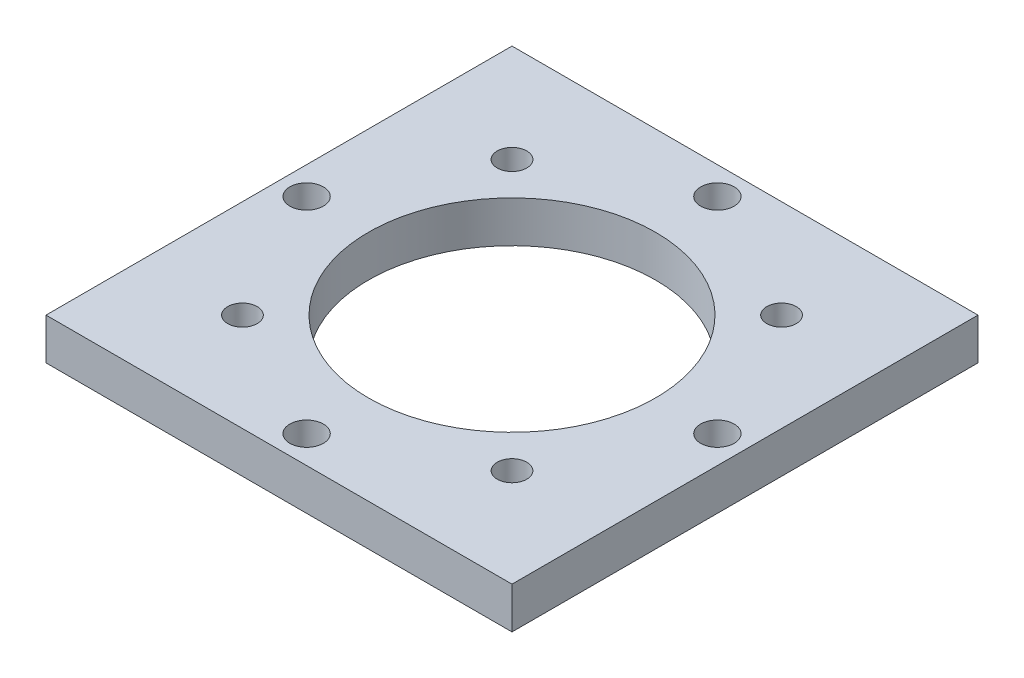
from build123d import *

# Parameters (mm, degrees)
SKETCH1_W           = 53.594
SKETCH1_H           = 53.594
SKETCH1_R           = 16.51
SKETCH1_R_2         = 1.7
SKETCH1_R_3         = 1.926649595
BOSS_EXTRUDE1_DEPTH = 4.7625


with BuildPart() as part:
    # Sketch1 → Boss-Extrude1 (new body)
    with BuildSketch(Plane(origin=(0, 0, 0), x_dir=(1, 0, 0), z_dir=(0, 1, 0))):
        Rectangle(SKETCH1_W, SKETCH1_H)
        Circle(SKETCH1_R, mode=Mode.SUBTRACT)
        with Locations((-15.5, 15.5)):
            Circle(SKETCH1_R_2, mode=Mode.SUBTRACT)
        with Locations((15.5, 15.5)):
            Circle(SKETCH1_R_2, mode=Mode.SUBTRACT)
        with Locations((15.5, -15.5)):
            Circle(SKETCH1_R_2, mode=Mode.SUBTRACT)
        with Locations((-15.5, -15.5)):
            Circle(SKETCH1_R_2, mode=Mode.SUBTRACT)
        with Locations((0, 23.622)):
            Circle(SKETCH1_R_3, mode=Mode.SUBTRACT)
        with Locations((23.622, 0)):
            Circle(SKETCH1_R_3, mode=Mode.SUBTRACT)
        with Locations((0, -23.622)):
            Circle(SKETCH1_R_3, mode=Mode.SUBTRACT)
        with Locations((-23.622, 0)):
            Circle(SKETCH1_R_3, mode=Mode.SUBTRACT)
    extrude(amount=BOSS_EXTRUDE1_DEPTH)


solid = part.part
